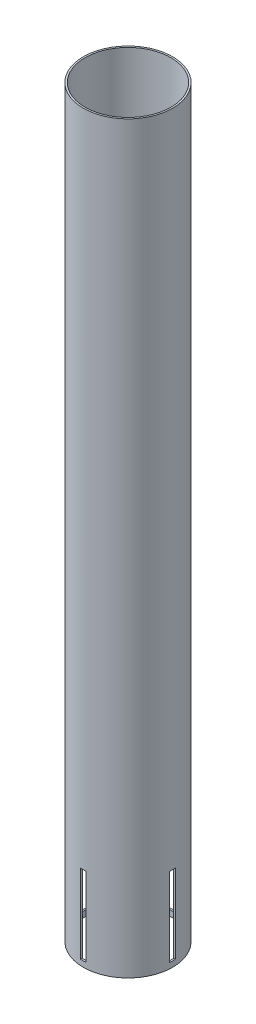
from build123d import *

# Parameters (mm, degrees)
SKETCH1_R           = 39.6
SKETCH1_R_2         = 38.1
BOSS_EXTRUDE1_DEPTH = 660
SKETCH2_W           = 5
SKETCH2_H           = 70
CUT_EXTRUDE1_DEPTH  = 663.371738528
CIRPATTERN1_COUNT   = 4


with BuildPart() as part:
    # Sketch1 → Boss-Extrude1 (new body)
    with BuildSketch(Plane(origin=(0, 0, 0), x_dir=(1, 0, 0), z_dir=(0, 1, 0))):
        Circle(SKETCH1_R)
        Circle(SKETCH1_R_2, mode=Mode.SUBTRACT)
    extrude(amount=BOSS_EXTRUDE1_DEPTH)

    # Sketch2 → Cut-Extrude1 (cut, through all)
    with BuildSketch(Plane.XY):
        with Locations((0, 40)):
            Rectangle(SKETCH2_W, SKETCH2_H)
    cut_extrude1 = extrude(amount=-CUT_EXTRUDE1_DEPTH, mode=Mode.SUBTRACT)

    # CirPattern1: Cut-Extrude1 ×4 about axis
    cirpattern1_axis = Axis((0, 0, 0), (0, 1, 0))
    for i in range(1, CIRPATTERN1_COUNT):
        add(cut_extrude1.rotate(cirpattern1_axis, i * 360 / CIRPATTERN1_COUNT), mode=Mode.SUBTRACT)


solid = part.part
